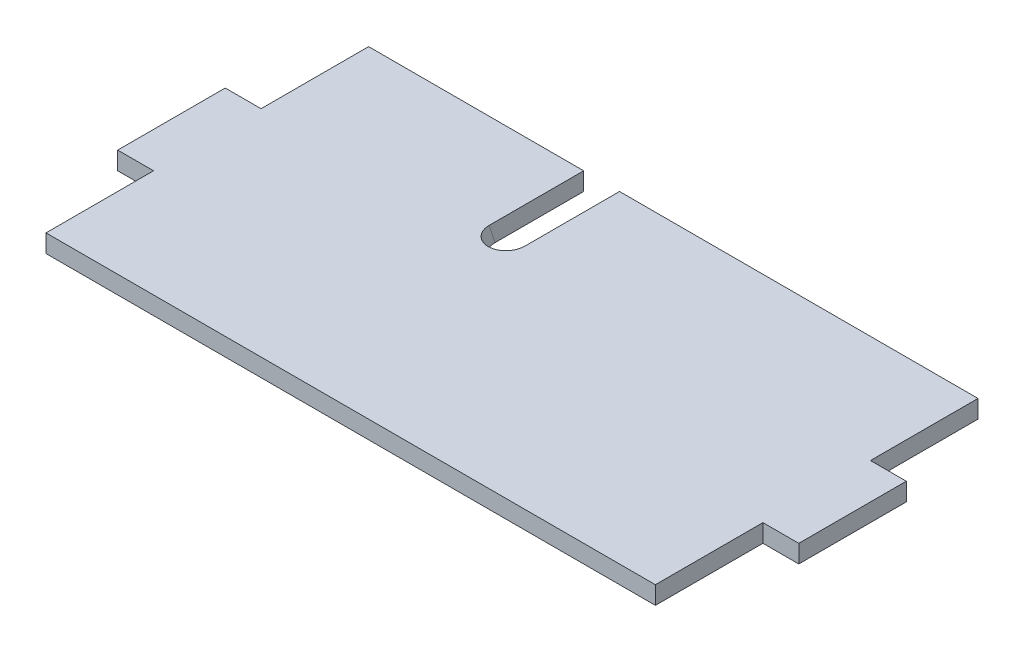
from build123d import *

# Parameters (mm, degrees)
BOSS_EXTRUDE1_DEPTH     = 6.35
CAVITY1_START           = -18.343561252
CAVITY1_OUTLINE_R       = 12.7
CAVITY1_DEPTH           = 21.704189785
CUT_EXTRUDE1_REACH      = 334.451
CUT_EXTRUDE1_END_RADIUS = 12.7
SKETCH3_W               = 25.4
SKETCH3_H               = 12.7


# Read off the part's stored shape, not the designer's step: Cavity1
with BuildPart() as part:
    # Sketch1 → Boss-Extrude1 (new, symmetric)
    with BuildSketch(Plane(origin=(0, 0, 0), x_dir=(1, 0, 0), z_dir=(0, 1, 0))):
        Polygon((-215.9, -139.7), (215.9, -139.7), (215.9, -63.5), (241.3, -63.5), (241.3, 12.7), (215.9, 12.7), (215.9, 88.9), (-215.9, 88.9), (-215.9, 12.7), (-241.3, 12.7), (-241.3, -63.5), (-215.9, -63.5), align=None)
    extrude(amount=BOSS_EXTRUDE1_DEPTH, both=True)

    # Cavity1 outline → Cavity1 (cut)
    with BuildSketch(Plane(origin=(0, 0, 0), x_dir=(1, 0, 0), z_dir=(0, 0.9501228611580823, 0.3118758546357501)).offset(CAVITY1_START)):
        with Locations((-50.8, 22.822585801)):
            Circle(CAVITY1_OUTLINE_R)
    extrude(amount=CAVITY1_DEPTH, mode=Mode.SUBTRACT)

    # Cut-Extrude1: up to this cylinder (the profile starts outside it)
    cut_extrude1_end = Plane(origin=(-50.8, -19.225068271, -30.3312567), z_dir=(0, 0.9501228611580824, 0.3118758546357496)) * Cylinder(CUT_EXTRUDE1_END_RADIUS, 695.302, mode=Mode.PRIVATE)
    # Sketch3 → Cut-Extrude1 (cut, up to the surface)
    with BuildSketch(Plane(origin=(0, 0, -88.9), x_dir=(-1, 0, 0), z_dir=(0, 0, -1)), mode=Mode.PRIVATE) as cut_extrude1_sk1:
        with Locations((50.8, 0)):
            Rectangle(SKETCH3_W, SKETCH3_H)
    cut_extrude1_tool1 = extrude(cut_extrude1_sk1.sketch, amount=-CUT_EXTRUDE1_REACH, mode=Mode.PRIVATE) - cut_extrude1_end
    add(cut_extrude1_tool1.solids().sort_by_distance((-50.8, 0, -88.9))[0], mode=Mode.SUBTRACT)


solid = part.part
